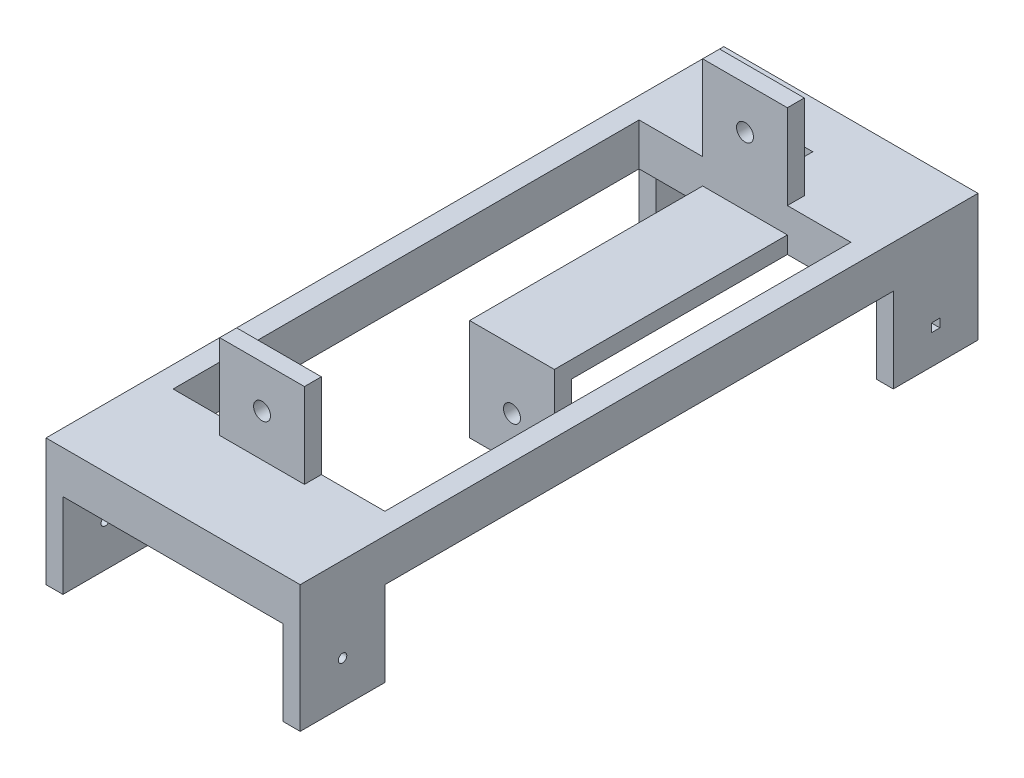
from build123d import *

# Parameters (mm, degrees)
SKETCH1_W                = 30
SKETCH1_H                = 80
BOSS_EXTRUDE1_DEPTH      = 5
SKETCH2_W                = 10
SKETCH2_H                = 10
BOSS_EXTRUDE2_DEPTH      = 30
CUT_EXTRUDE1_DEPTH       = 51.990195136
CUT_EXTRUDE1_DEPTH_BACK  = 51.990195136
SKETCH3_R                = 0.5
SKETCH3_W                = 1
SKETCH3_H                = 1
CUT_EXTRUDE2_DEPTH       = 46.276925691
CUT_EXTRUDE2_DEPTH_BACK  = 46.276925691
SKETCH4_W                = 25
SKETCH4_H                = 55
CUT_EXTRUDE3_DEPTH       = 83.006097334
CUT_EXTRUDE3_DEPTH_BACK  = 83.006097334
SKETCH5_W                = 26
SKETCH5_H                = 10
SKETCH6_W                = 10
SKETCH6_H                = 10
BOSS_EXTRUDE3_DEPTH      = 80
CUT_EXTRUDE4_DEPTH       = 83.006097334
CUT_EXTRUDE4_DEPTH_BACK  = 83.006097334
SKETCH7_R                = 1
CUT_EXTRUDE5_DEPTH       = 46.82575695
CUT_EXTRUDE5_DEPTH_BACK  = 46.82575695
SKETCH8_W                = 56
SKETCH8_H                = 10
SKETCH9_W                = 10
SKETCH9_H                = 10
CUT_EXTRUDE6_DEPTH       = 10
SKETCH10_W               = 10
SKETCH10_H               = 10
CUT_EXTRUDE7_DEPTH       = 10
SKETCH12_W               = 10
SKETCH12_H               = 2
BOSS_EXTRUDE5_DEPTH      = 10
CUT_EXTRUDE8_DEPTH       = 73.665328734
CUT_EXTRUDE8_DEPTH_BACK  = 73.665328734
SKETCH13_R               = 1
CUT_EXTRUDE11_DEPTH      = 46.276925691
CUT_EXTRUDE11_DEPTH_BACK = 46.276925691
SKETCH15_W               = 2
SKETCH15_H               = 2
SKETCH16_W               = 10
SKETCH16_H               = 10
BOSS_EXTRUDE6_DEPTH      = 30
SKETCH17_W               = 10
SKETCH17_H               = 10
CUT_EXTRUDE12_DEPTH      = 28
CUT_EXTRUDE13_DEPTH      = 48.053161424
CUT_EXTRUDE13_DEPTH_BACK = 48.053161424
SKETCH18_R               = 1
SKETCH20_W               = 10
SKETCH20_H               = 2
BOSS_EXTRUDE7_DEPTH      = 40


with BuildPart() as part:
    # Sketch1 → Boss-Extrude1 (new body)
    with BuildSketch(Plane(origin=(0, 0, 0), x_dir=(1, 0, 0), z_dir=(0, 1, 0))):
        Rectangle(SKETCH1_W, SKETCH1_H)
    extrude(amount=BOSS_EXTRUDE1_DEPTH)

    # Sketch2 → Boss-Extrude2 (add)
    with BuildSketch(Plane(origin=(15, 0, 0), x_dir=(0, 0, -1), z_dir=(1, 0, 0))):
        with Locations((-35, -5)):
            Rectangle(SKETCH2_W, SKETCH2_H)
        with Locations((35, -5)):
            Rectangle(SKETCH2_W, SKETCH2_H)
    extrude(amount=-BOSS_EXTRUDE2_DEPTH)

    # Sketch3 → Cut-Extrude1 (cut, two sides: drawn at the far end of the back side and taken through both)
    with BuildSketch(Plane(origin=(15, 0, 0), x_dir=(0, 0, -1), z_dir=(1, 0, 0)).offset(-CUT_EXTRUDE1_DEPTH_BACK)):
        with Locations((-35, -5)):
            Circle(SKETCH3_R)
        with Locations((35, -6)):
            Rectangle(SKETCH3_W, SKETCH3_H)
    extrude(amount=CUT_EXTRUDE1_DEPTH + CUT_EXTRUDE1_DEPTH_BACK, mode=Mode.SUBTRACT)

    # Sketch4 → Cut-Extrude2 (cut, two sides: drawn at the far end of the back side and taken through both)
    with BuildSketch(Plane(origin=(0, 5, 0), x_dir=(1, 0, 0), z_dir=(0, 1, 0)).offset(-CUT_EXTRUDE2_DEPTH_BACK)):
        Rectangle(SKETCH4_W, SKETCH4_H)
    extrude(amount=CUT_EXTRUDE2_DEPTH + CUT_EXTRUDE2_DEPTH_BACK, mode=Mode.SUBTRACT)

    # Sketch5 → Cut-Extrude3 (cut, two sides: drawn at the far end of the back side and taken through both)
    with BuildSketch(Plane(origin=(0, 0, -40), x_dir=(-1, 0, 0), z_dir=(0, 0, -1)).offset(-CUT_EXTRUDE3_DEPTH_BACK)):
        with Locations((0, -5)):
            Rectangle(SKETCH5_W, SKETCH5_H)
    extrude(amount=CUT_EXTRUDE3_DEPTH + CUT_EXTRUDE3_DEPTH_BACK, mode=Mode.SUBTRACT)

    # Sketch6 → Boss-Extrude3 (add)
    with BuildSketch(Plane(origin=(0, 0, -40), x_dir=(-1, 0, 0), z_dir=(0, 0, -1))):
        with Locations((0, -5)):
            Rectangle(SKETCH6_W, SKETCH6_H)
    extrude(amount=-BOSS_EXTRUDE3_DEPTH)

    # Sketch7 → Cut-Extrude4 (cut, two sides: drawn at the far end of the back side and taken through both)
    with BuildSketch(Plane(origin=(0, 0, -40), x_dir=(-1, 0, 0), z_dir=(0, 0, -1)).offset(-CUT_EXTRUDE4_DEPTH_BACK)):
        with Locations((0, -5)):
            Circle(SKETCH7_R)
    extrude(amount=CUT_EXTRUDE4_DEPTH + CUT_EXTRUDE4_DEPTH_BACK, mode=Mode.SUBTRACT)

    # Sketch8 → Cut-Extrude5 (cut, two sides: drawn at the far end of the back side and taken through both)
    with BuildSketch(Plane(origin=(5, 0, 0), x_dir=(0, 0, -1), z_dir=(1, 0, 0)).offset(-CUT_EXTRUDE5_DEPTH_BACK)):
        with Locations((0, -5)):
            Rectangle(SKETCH8_W, SKETCH8_H)
    extrude(amount=CUT_EXTRUDE5_DEPTH + CUT_EXTRUDE5_DEPTH_BACK, mode=Mode.SUBTRACT)

    # Sketch9 → Cut-Extrude6 (cut)
    with BuildSketch(Plane.XY.offset(40)):
        with Locations((0, -5)):
            Rectangle(SKETCH9_W, SKETCH9_H)
    extrude(amount=-CUT_EXTRUDE6_DEPTH, mode=Mode.SUBTRACT)

    # Sketch10 → Cut-Extrude7 (cut)
    with BuildSketch(Plane(origin=(0, 0, -40), x_dir=(-1, 0, 0), z_dir=(0, 0, -1))):
        with Locations((0, -5)):
            Rectangle(SKETCH10_W, SKETCH10_H)
    extrude(amount=-CUT_EXTRUDE7_DEPTH, mode=Mode.SUBTRACT)

    # Sketch12 → Boss-Extrude5 (add)
    with BuildSketch(Plane(origin=(0, 5, 0), x_dir=(1, 0, 0), z_dir=(0, 1, 0))):
        with Locations((0, -28.5)):
            Rectangle(SKETCH12_W, SKETCH12_H)
        with Locations((0, 28.5)):
            Rectangle(SKETCH12_W, SKETCH12_H)
    extrude(amount=BOSS_EXTRUDE5_DEPTH)

    # Sketch13 → Cut-Extrude8 (cut, two sides: drawn at the far end of the back side and taken through both)
    with BuildSketch(Plane.XY.offset(29.5).offset(-CUT_EXTRUDE8_DEPTH_BACK)):
        with Locations((0, 10)):
            Circle(SKETCH13_R)
    extrude(amount=CUT_EXTRUDE8_DEPTH + CUT_EXTRUDE8_DEPTH_BACK, mode=Mode.SUBTRACT)

    # Sketch15 → Cut-Extrude11 (cut, two sides: drawn at the far end of the back side and taken through both)
    with BuildSketch(Plane(origin=(0, 5, 0), x_dir=(1, 0, 0), z_dir=(0, 1, 0)).offset(-CUT_EXTRUDE11_DEPTH_BACK)):
        with Locations((0, 33.5)):
            Rectangle(SKETCH15_W, SKETCH15_H)
    extrude(amount=CUT_EXTRUDE11_DEPTH + CUT_EXTRUDE11_DEPTH_BACK, mode=Mode.SUBTRACT)

    # Sketch16 → Boss-Extrude6 (add)
    with BuildSketch(Plane(origin=(0, 0, -30), x_dir=(-1, 0, 0), z_dir=(0, 0, -1))):
        with Locations((0, -5)):
            Rectangle(SKETCH16_W, SKETCH16_H)
    extrude(amount=-BOSS_EXTRUDE6_DEPTH)

    # Sketch17 → Cut-Extrude12 (cut)
    with BuildSketch(Plane(origin=(0, 0, -30), x_dir=(-1, 0, 0), z_dir=(0, 0, -1))):
        with Locations((0, -5)):
            Rectangle(SKETCH17_W, SKETCH17_H)
    extrude(amount=-CUT_EXTRUDE12_DEPTH, mode=Mode.SUBTRACT)


with BuildPart() as cut_extrude12_piece_1:
    # of the separate pieces the step leaves, piece 1, a body of its own (cut_extrude12_pieces)
    add(part.part.solids().sort_by_distance((-13, -10, -40))[0])



with BuildPart() as cut_extrude12_piece_2:
    # of the separate pieces the step leaves, piece 2, a body of its own (cut_extrude12_pieces)
    add(part.part.solids().sort_by_distance((-5, 0, -2))[0])

    # Sketch18 → Cut-Extrude13 (cut, two sides: drawn at the far end of the back side and taken through both)
    with BuildSketch(Plane(origin=(0, 0, -2), x_dir=(-1, 0, 0), z_dir=(0, 0, -1)).offset(-CUT_EXTRUDE13_DEPTH_BACK)):
        with Locations((0, -5)):
            Circle(SKETCH18_R)
    extrude(amount=CUT_EXTRUDE13_DEPTH + CUT_EXTRUDE13_DEPTH_BACK, mode=Mode.SUBTRACT)


with BuildPart() as cut_extrude12_piece_1_1:
    add(cut_extrude12_piece_1.part)

    add(cut_extrude12_piece_2.part)  # Boss-Extrude7 merges Cut-Extrude12 piece 2
    # Sketch20 → Boss-Extrude7 (add)
    with BuildSketch(Plane(origin=(0, 0, -40), x_dir=(-1, 0, 0), z_dir=(0, 0, -1))):
        with Locations((0, 1)):
            Rectangle(SKETCH20_W, SKETCH20_H)
    extrude(amount=-BOSS_EXTRUDE7_DEPTH)


solid = cut_extrude12_piece_1_1.part
